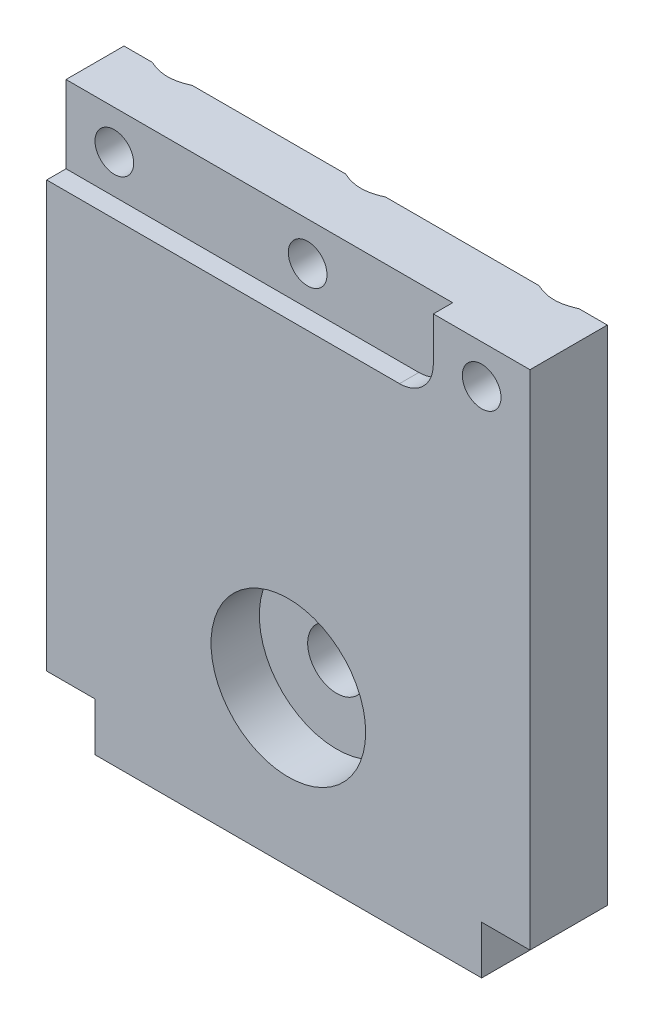
from build123d import *

# Parameters (mm, degrees)
BOSS_EXTRU_1_DEPTH      = 8
ESQUISSE2_R             = 2
ENL_V_MAT_EXTRU_1_DEPTH = 10
ESQUISSE3_R             = 2
ENL_V_MAT_EXTRU_2_DEPTH = 39.745967532
CHANFREIN1_SIZE         = 2.5
ESQUISSE4_R             = 8
ENL_V_MAT_EXTRU_3_DEPTH = 5
ESQUISSE5_R             = 3
ENL_V_MAT_EXTRU_4_DEPTH = 39.23937761
ESQUISSE6_W             = 40
ESQUISSE6_H             = 8
ENL_V_MAT_EXTRU_5_DEPTH = 2
CONG_1_R                = 3.5


with BuildPart() as part:
    # Esquisse1 → Boss.-Extru.1 (new body)
    with BuildSketch(Plane.XY):
        Polygon((-25, -23.5), (-20, -23.5), (-20, -28.5), (20, -28.5), (20, -23.5), (25, -23.5), (25, 28.5), (-25, 28.5), align=None)
    extrude(amount=BOSS_EXTRU_1_DEPTH)

    # Esquisse2 → Enlèv. mat.-Extru.1 (cut)
    with BuildSketch(Plane.XZ.offset(28.5)):
        with Locations(Location((-15, 4, 0), (0, 0, 270))):
            Circle(ESQUISSE2_R)
        with Locations(Location((15, 4, 0), (0, 0, 270))):
            Circle(ESQUISSE2_R)
    extrude(amount=-ENL_V_MAT_EXTRU_1_DEPTH, mode=Mode.SUBTRACT)

    # Esquisse3 → Enlèv. mat.-Extru.2 (cut, through all)
    with BuildSketch(Plane.XY.offset(8)):
        with Locations((-20, 24.5)):
            Circle(ESQUISSE3_R)
        with Locations((20, 24.5)):
            Circle(ESQUISSE3_R)
        with Locations((0, 24.5)):
            Circle(ESQUISSE3_R)
    extrude(amount=-ENL_V_MAT_EXTRU_2_DEPTH, mode=Mode.SUBTRACT)

    # Chanfrein1
    # the kernel refuses this chamfer: 2.5 mm, written as the material it takes off along each edge
    with BuildSketch(Plane(origin=(-20, 24.5, 0), x_dir=(1, 0, 0), z_dir=(0, -1, 0))) as chanfrein1_piece_1:
        Polygon((2 + CHANFREIN1_SIZE, 0), (2, CHANFREIN1_SIZE), (2, 0), align=None)
    revolve(axis=Axis((-20, 24.5, 0), (0, 0, 1)), mode=Mode.SUBTRACT)
    with BuildSketch(Plane(origin=(20, 24.5, 0), x_dir=(1, 0, 0), z_dir=(0, -1, 0))) as chanfrein1_piece_2:
        Polygon((2 + CHANFREIN1_SIZE, 0), (2, CHANFREIN1_SIZE), (2, 0), align=None)
    revolve(axis=Axis((20, 24.5, 0), (0, 0, 1)), mode=Mode.SUBTRACT)
    with BuildSketch(Plane(origin=(0, 24.5, 0), x_dir=(1, 0, 0), z_dir=(0, -1, 0))) as chanfrein1_piece_3:
        Polygon((2 + CHANFREIN1_SIZE, 0), (2, CHANFREIN1_SIZE), (2, 0), align=None)
    revolve(axis=Axis((0, 24.5, 0), (0, 0, 1)), mode=Mode.SUBTRACT)

    # Esquisse4 → Enlèv. mat.-Extru.3 (cut)
    with BuildSketch(Plane.XY.offset(8)):
        with Locations((0, -12.5)):
            Circle(ESQUISSE4_R)
    extrude(amount=-ENL_V_MAT_EXTRU_3_DEPTH, mode=Mode.SUBTRACT)

    # Esquisse5 → Enlèv. mat.-Extru.4 (cut, through all)
    with BuildSketch(Plane.XY.offset(3)):
        with Locations((0, -12.5)):
            Circle(ESQUISSE5_R)
    extrude(amount=-ENL_V_MAT_EXTRU_4_DEPTH, mode=Mode.SUBTRACT)

    # Esquisse6 → Enlèv. mat.-Extru.5 (cut)
    with BuildSketch(Plane.XY.offset(8)):
        with Locations((-5, 24.5)):
            Rectangle(ESQUISSE6_W, ESQUISSE6_H)
    extrude(amount=-ENL_V_MAT_EXTRU_5_DEPTH, mode=Mode.SUBTRACT)

    # Congé1
    cong_1_edges = [part.edges().sort_by_distance(p)[0] for p in [
        (15, 20.5, 7),
    ]]
    fillet(cong_1_edges, radius=CONG_1_R)


solid = part.part
